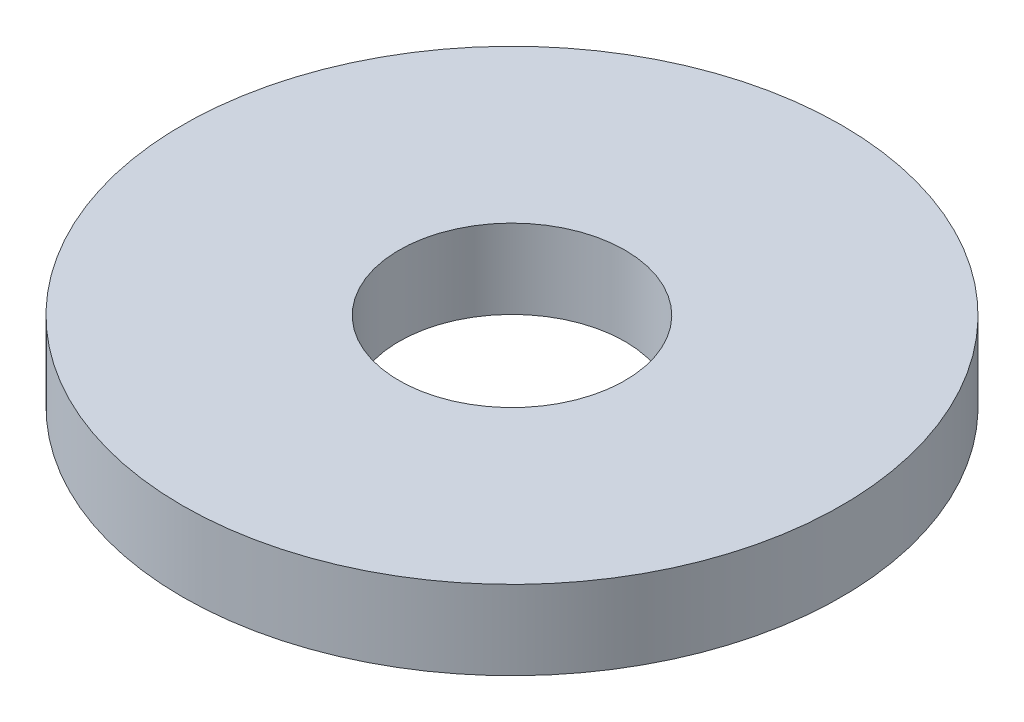
from build123d import *

# Parameters (mm, degrees)
SKETCH1_R           = 87.5
BOSS_EXTRUDE1_DEPTH = 21
SKETCH2_R           = 30
CUT_EXTRUDE1_DEPTH  = 126.512947539


with BuildPart() as part:
    # Sketch1 → Boss-Extrude1 (new body)
    with BuildSketch(Plane(origin=(0, 0, 0), x_dir=(1, 0, 0), z_dir=(0, 1, 0))):
        Circle(SKETCH1_R)
    extrude(amount=BOSS_EXTRUDE1_DEPTH)

    # Sketch2 → Cut-Extrude1 (cut, through all)
    with BuildSketch(Plane(origin=(0, 0, 0), x_dir=(1, 0, 0), z_dir=(0, 1, 0))):
        Circle(SKETCH2_R)
    extrude(amount=CUT_EXTRUDE1_DEPTH, mode=Mode.SUBTRACT)


solid = part.part
